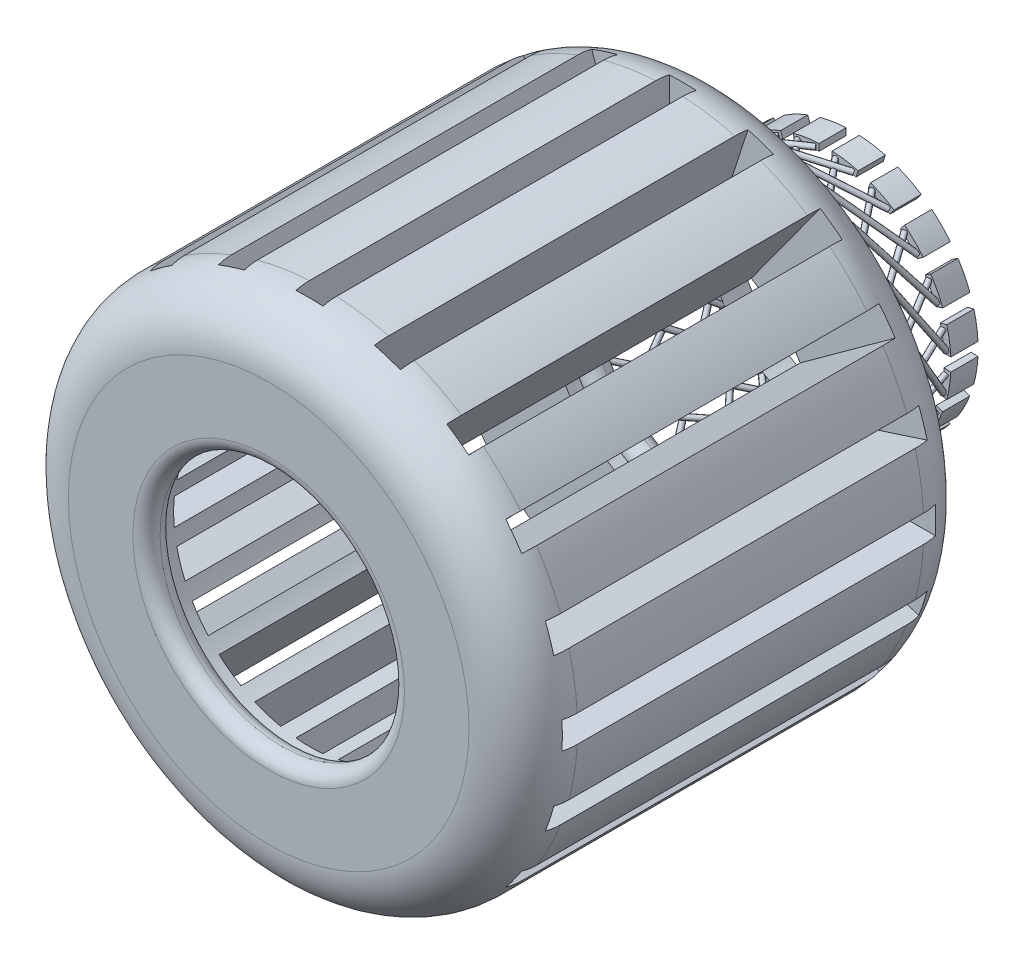
from build123d import *
from build123d.topology import SkipClean

# Parameters (mm, degrees)
ESQUISSE2_R                  = 37.5
ESQUISSE2_R_2                = 20
EXTRUSION1_DEPTH             = 2
EXTRUSION2_START             = 55
EXTRUSION2_DEPTH             = 55
R_P_TITION_CIRCULAIRE1_COUNT = 20
EXTRUSION3_START             = 2
ESQUISSE5_R                  = 37.5
ESQUISSE5_R_2                = 20
EXTRUSION3_DEPTH             = 2
EXTRUSION4_START             = 4
ESQUISSE7_R                  = 37.5
ESQUISSE7_R_2                = 18
EXTRUSION4_DEPTH             = 4
ESQUISSE8_R                  = 37.5
ESQUISSE8_R_2                = 18
EXTRUSION5_DEPTH             = 4
CONG_1_R                     = 8
CONG_2_R                     = 2
ESQUISSE11_R                 = 0.375
R_P_TITION_CIRCULAIRE2_COUNT = 20
ESQUISSE12_R                 = 0.375
R_P_TITION_CIRCULAIRE3_COUNT = 20
EXTRUSION6_DEPTH             = 4
R_P_TITION_CIRCULAIRE4_COUNT = 20


# Some blends are built 0.0001 mm under size
with BuildPart() as part:
    # Esquisse2 → Extrusion1 (new body)
    with BuildSketch(Plane.XY):
        Circle(ESQUISSE2_R)
        Circle(ESQUISSE2_R_2, mode=Mode.SUBTRACT)
    extrude(amount=EXTRUSION1_DEPTH)

    # Esquisse4 → Extrusion2 (add)
    with SkipClean():  # the faces are left unmerged after this step: merging them gives an invalid solid
        with BuildSketch(Plane(origin=(0, 0, 0), x_dir=(-1, 0, 0), z_dir=(0, 0, -1)).offset(EXTRUSION2_START)):
            with BuildLine():
                Line((2, 37.446628687), (2, 19.899748742))
                ThreePointArc((2, 19.899748742), (3.128689301, 19.753766812), (4.247247513, 19.543819703))
                Line((4.247247513, 19.543819703), (9.669531614, 36.231894215))
                ThreePointArc((9.669531614, 36.231894215), (5.866292439, 37.038312772), (2, 37.446628687))
            make_face()
        extrusion2 = extrude(amount=-EXTRUSION2_DEPTH)

    # Répétition circulaire1: Extrusion2 ×20 about axis
    with SkipClean():  # the faces are left unmerged after this step: merging them gives an invalid solid
        r_p_tition_circulaire1_axis = Axis((0, 0, 0), (0, 0, 1))
        for i in range(1, R_P_TITION_CIRCULAIRE1_COUNT):
            add(extrusion2.rotate(r_p_tition_circulaire1_axis, i * 360 / R_P_TITION_CIRCULAIRE1_COUNT))

    # Esquisse5 → Extrusion3 (add)
    with SkipClean():  # the faces are left unmerged after this step: merging them gives an invalid solid
        with BuildSketch(Plane(origin=(0, 0, -55), x_dir=(-1, 0, 0), z_dir=(0, 0, -1)).offset(EXTRUSION3_START)):
            Circle(ESQUISSE5_R)
            Circle(ESQUISSE5_R_2, mode=Mode.SUBTRACT)
        extrude(amount=-EXTRUSION3_DEPTH)

    # Esquisse7 → Extrusion4 (add)
    with SkipClean():  # the faces are left unmerged after this step: merging them gives an invalid solid
        with BuildSketch(Plane(origin=(0, 0, -57), x_dir=(-1, 0, 0), z_dir=(0, 0, -1)).offset(EXTRUSION4_START)):
            Circle(ESQUISSE7_R)
            Circle(ESQUISSE7_R_2, mode=Mode.SUBTRACT)
        extrude(amount=-EXTRUSION4_DEPTH)

    # Esquisse8 → Extrusion5 (add)
    with BuildSketch(Plane.XY.offset(2)):
        with Locations(Location((0, 0, 0), (0, 0, 180))):
            Circle(ESQUISSE8_R)
        with Locations(Location((0, 0, 0), (0, 0, 180))):
            Circle(ESQUISSE8_R_2, mode=Mode.SUBTRACT)
    extrude(amount=EXTRUSION5_DEPTH)

    # Congé1
    # the kernel refuses this fillet: 8 mm, written as the material it takes off along each edge
    with BuildSketch(Plane(origin=(0, 0, -61), x_dir=(-1, 0, 0), z_dir=(0, -1, 0))) as cong_1_piece_1:
        with BuildLine():
            CenterArc((37.5 - CONG_1_R, -CONG_1_R), CONG_1_R, 0, 90)
            Line((37.5 - CONG_1_R, 0), (37.5, 0))
            Line((37.5, 0), (37.5, -CONG_1_R))
        make_face()
    revolve(axis=Axis((0, 0, -61), (0, 0, -1)), mode=Mode.SUBTRACT)
    with BuildSketch(Plane(origin=(0, 0, 6), x_dir=(-1, 0, 0), z_dir=(0, 1, 0))) as cong_1_piece_2:
        with BuildLine():
            CenterArc((37.5 - CONG_1_R, -CONG_1_R), CONG_1_R, 0, 90)
            Line((37.5 - CONG_1_R, 0), (37.5, 0))
            Line((37.5, 0), (37.5, -CONG_1_R))
        make_face()
    revolve(axis=Axis((0, 0, 6), (0, 0, 1)), mode=Mode.SUBTRACT)

    # Congé2
    cong_2_edges = [part.edges().sort_by_distance(p)[0] for p in [
        (18, 0, -57),
        (18, 0, -61),
        (18, 0, 2),
        (18, 0, 6),
    ]]
    fillet(cong_2_edges, radius=CONG_2_R - 0.0001)  # a hair under: the kernel refuses the full size

    # Balayage1: sweep along a curve in space
    with BuildLine() as balayage1_path:
        Line((-1.389391314, 17.820920761, -76), (-23.508823519, 17.820920761, -61))
    # Esquisse11 → Balayage1 (sweep)
    with BuildSketch(Plane(origin=(-1.389391314, 17.820920761, -76), x_dir=(0.5612550643264793, 0, 0.8276428896377227), z_dir=(-0.8276428896377227, 0, 0.5612550643264793))):
        Circle(ESQUISSE11_R)
    balayage1 = sweep(path=balayage1_path.line)

    # Répétition circulaire2: Balayage1 ×20 about axis
    r_p_tition_circulaire2_axis = Axis((0, 0, 0), (0, 0, 1))
    for i in range(1, R_P_TITION_CIRCULAIRE2_COUNT):
        add(balayage1.rotate(r_p_tition_circulaire2_axis, i * 360 / R_P_TITION_CIRCULAIRE2_COUNT))

    # Balayage2: sweep along a curve in space
    with BuildLine() as balayage2_path:
        Line((-4.110160558, 17.396039928, -76), (8.29497567, 18.198719148, -61))
    # Esquisse12 → Balayage2 (sweep)
    with BuildSketch(Plane(origin=(-4.110160558, 17.396039928, -76), x_dir=(0.7710592092165086, -0.03541787036878212, -0.6357776894016907), z_dir=(0.6367625462264487, 0.04120197106677632, 0.7699583477717626))):
        Circle(ESQUISSE12_R)
    balayage2 = sweep(path=balayage2_path.line)

    # Répétition circulaire3: Balayage2 ×20 about axis
    r_p_tition_circulaire3_axis = Axis((0, 0, 0), (0, 0, 1))
    for i in range(1, R_P_TITION_CIRCULAIRE3_COUNT):
        add(balayage2.rotate(r_p_tition_circulaire3_axis, i * 360 / R_P_TITION_CIRCULAIRE3_COUNT))

    # Esquisse13 → Extrusion6 (add)
    with BuildSketch(Plane(origin=(0, 0, -76), x_dir=(-1, 0, 0), z_dir=(0, 0, -1))):
        with BuildLine():
            Line((0.930230135, 17.475258851), (0.930230135, 18.476597952))
            ThreePointArc((0.930230135, 18.476597952), (2.861569049, 18.277347252), (4.761388724, 17.876777602))
            Line((4.761388724, 17.876777602), (4.504016361, 16.910465299))
            ThreePointArc((4.504016361, 16.910465299), (2.731758899, 17.285470584), (0.930230135, 17.475258851))
        make_face()
    extrusion6 = extrude(amount=EXTRUSION6_DEPTH)

    # Répétition circulaire4: Extrusion6 ×20 about axis
    r_p_tition_circulaire4_axis = Axis((0, 0, 0), (0, 0, 1))
    for i in range(1, R_P_TITION_CIRCULAIRE4_COUNT):
        add(extrusion6.rotate(r_p_tition_circulaire4_axis, i * 360 / R_P_TITION_CIRCULAIRE4_COUNT))


solid = part.part
